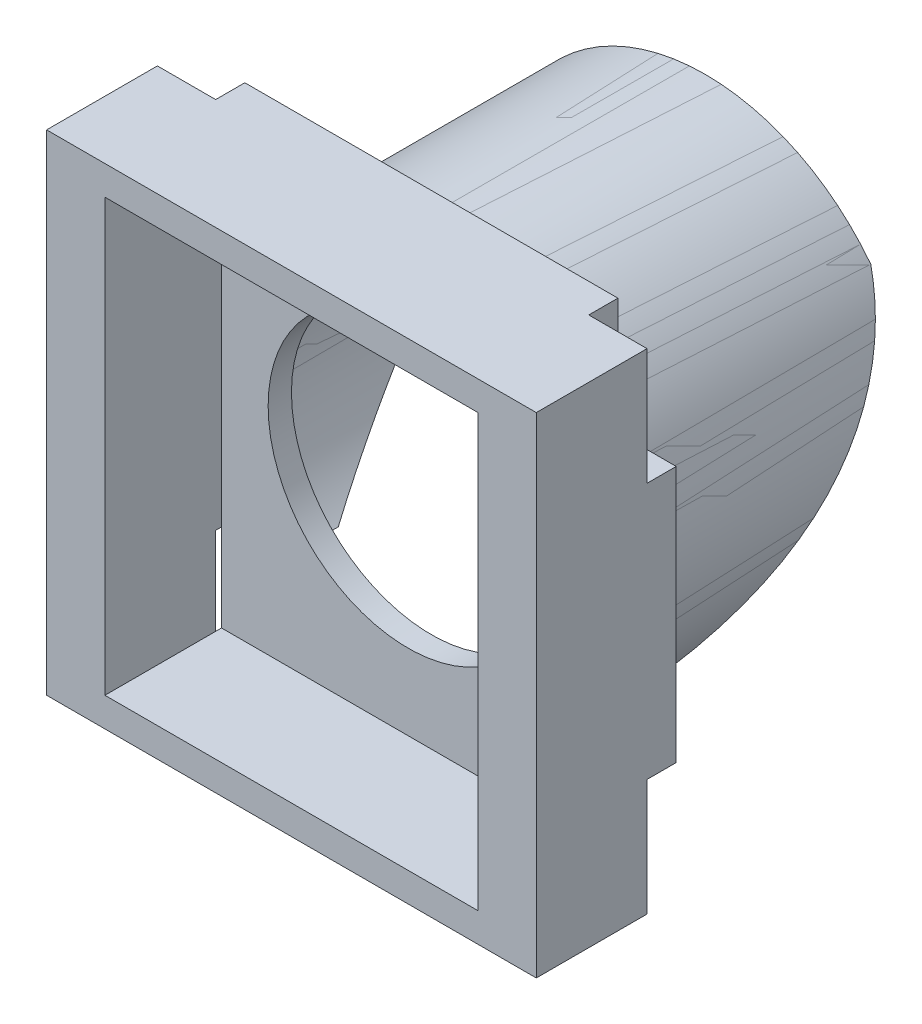
from build123d import *

# Parameters (mm, degrees)
SKETCH2_W           = 350
SKETCH2_H           = 1050
SKETCH2_R           = 100
BOSS_EXTRUDE2_DEPTH = 100
SCALE1_SCALE        = 0.24
SKETCH6_W           = 84
SKETCH6_H           = 168
CUT_EXTRUDE3_DEPTH  = 80
SKETCH11_W          = 64
SKETCH11_H          = 74
CUT_EXTRUDE8_DEPTH  = 20
SKETCH12_W          = 10
SKETCH12_H          = 5
BOSS_EXTRUDE6_DEPTH = 20
SKETCH13_W          = 10
SKETCH13_H          = 5
BOSS_EXTRUDE7_DEPTH = 20
SKETCH14_W          = 10
SKETCH14_H          = 5
CUT_EXTRUDE9_DEPTH  = 40
SKETCH15_W          = 10
SKETCH15_H          = 5
CUT_EXTRUDE10_DEPTH = 40
SKETCH16_W          = 10
SKETCH16_H          = 20
CUT_EXTRUDE11_DEPTH = 5
SKETCH17_W          = 10
SKETCH17_H          = 20
CUT_EXTRUDE12_DEPTH = 5
BOSS_EXTRUDE9_DEPTH = 47
SWEEP3_START        = -9
SWEEP3_DEPTH        = 47
CUT_EXTRUDE13_DEPTH = 82


# Read off the part's stored shape, not the designer's step: Sweep3
with BuildPart() as part:
    # Sketch2 → Boss-Extrude2 (new body)
    with BuildSketch(Plane.XY):
        with Locations((13.505164405, -303.545290931)):
            Rectangle(SKETCH2_W, SKETCH2_H)
        with Locations((13.505164405, 46.454709069)):
            Circle(SKETCH2_R, mode=Mode.SUBTRACT)
        with Locations((13.505164405, -303.545290931)):
            Circle(SKETCH2_R, mode=Mode.SUBTRACT)
        with Locations((13.505164405, -653.545290931)):
            Circle(SKETCH2_R, mode=Mode.SUBTRACT)
    extrude(amount=BOSS_EXTRUDE2_DEPTH)


with BuildPart() as part_1:
    # Scale1: scaled about (13.505164405, -303.545290931, 50)
    add(part.part.scale(SCALE1_SCALE).moved(Location((10.263924948, -230.694421108, 38))))

    # Sketch6 → Cut-Extrude3 (cut)
    with BuildSketch(Plane.XY.offset(62)):
        with Locations((13.505164405, -261.545290931)):
            Rectangle(SKETCH6_W, SKETCH6_H)
    extrude(amount=-CUT_EXTRUDE3_DEPTH, mode=Mode.SUBTRACT)

    # Sketch11 → Cut-Extrude8 (cut)
    with BuildSketch(Plane.XY.offset(62)):
        with Locations((13.505164405, -387.545290931)):
            Rectangle(SKETCH11_W, SKETCH11_H)
    extrude(amount=-CUT_EXTRUDE8_DEPTH, mode=Mode.SUBTRACT)

    # Sketch12 → Boss-Extrude6 (add)
    with BuildSketch(Plane(origin=(0, -429.545290931, 0), x_dir=(-1, 0, 0), z_dir=(0, -1, 0))):
        with Locations((23.494835595, -40.5)):
            Rectangle(SKETCH12_W, SKETCH12_H)
    extrude(amount=BOSS_EXTRUDE6_DEPTH)

    # Sketch13 → Boss-Extrude7 (add)
    with BuildSketch(Plane(origin=(0, -429.545290931, 0), x_dir=(-1, 0, 0), z_dir=(0, -1, 0))):
        with Locations((-50.505164405, -40.5)):
            Rectangle(SKETCH13_W, SKETCH13_H)
    extrude(amount=BOSS_EXTRUDE7_DEPTH)

    # Sketch14 → Cut-Extrude9 (cut)
    with BuildSketch(Plane.XZ.offset(449.545290931)):
        with Locations((-23.494835595, 40.5)):
            Rectangle(SKETCH14_W, SKETCH14_H)
    extrude(amount=-CUT_EXTRUDE9_DEPTH, mode=Mode.SUBTRACT)

    # Sketch15 → Cut-Extrude10 (cut)
    with BuildSketch(Plane(origin=(0, -449.545290931, 0), x_dir=(-1, 0, 0), z_dir=(0, -1, 0))):
        with Locations((-50.505164405, -40.5)):
            Rectangle(SKETCH15_W, SKETCH15_H)
    extrude(amount=-CUT_EXTRUDE10_DEPTH, mode=Mode.SUBTRACT)

    # Sketch16 → Cut-Extrude11 (cut)
    with BuildSketch(Plane(origin=(0, 0, 38), x_dir=(-1, 0, 0), z_dir=(0, 0, -1))):
        with Locations((23.494835595, -355.545290931)):
            Rectangle(SKETCH16_W, SKETCH16_H)
    extrude(amount=-CUT_EXTRUDE11_DEPTH, mode=Mode.SUBTRACT)

    # Sketch17 → Cut-Extrude12 (cut)
    with BuildSketch(Plane(origin=(0, 0, 38), x_dir=(-1, 0, 0), z_dir=(0, 0, -1))):
        with Locations((-50.505164405, -355.545290931)):
            Rectangle(SKETCH17_W, SKETCH17_H)
    extrude(amount=-CUT_EXTRUDE12_DEPTH, mode=Mode.SUBTRACT)

    # Sketch18 → Boss-Extrude9 (add)
    with BuildSketch(Plane(origin=(0, 0, 38), x_dir=(-1, 0, 0), z_dir=(0, 0, -1))):
        with BuildLine():
            Line((-35.671185106, -409.711311632), (-38.7770157, -412.817142227))
            ThreePointArc((-38.7770157, -412.817142227), (-13.505164405, -351.805496082), (11.766686891, -412.817142227))
            Line((11.766686891, -412.817142227), (8.660856297, -409.711311632))
            ThreePointArc((8.660856297, -409.711311632), (-13.505164405, -356.197803831), (-35.671185106, -409.711311632))
        make_face()
    extrude(amount=BOSS_EXTRUDE9_DEPTH)


with BuildPart() as body_2:
    # Sweep3 outline → Sweep3 (new body)
    with BuildSketch(Plane.XY.offset(SWEEP3_START)):
        with BuildLine():
            Line((35.671185106, -409.711311632), (38.7770157, -412.817142227))
            ThreePointArc((38.7770157, -412.817142227), (13.505164405, -351.805496082), (-11.766686891, -412.817142227))
            Line((-11.766686891, -412.817142227), (-8.660856297, -409.711311632))
            ThreePointArc((-8.660856297, -409.711311632), (13.505164404, -356.197803831), (35.671185106, -409.711311632))
        make_face()
    extrude(amount=SWEEP3_DEPTH)


with BuildPart() as cut_extrude13_tool:
    # Sketch27 → Cut-Extrude13 (new body)
    with BuildSketch(Plane.ZY.offset(28.494835595)):
        with BuildLine():
            Line((38, -412.817142227), (-9, -412.817142227))
            Line((-9, -412.817142227), (-9, -365.817142227))
            add(Edge.make_bspline(
                [(-9, -365.817142227), (5.370162337, -397.723377267), (38, -412.817142227)],
                knots=[0, 0, 0, 1, 1, 1], degree=2))
        make_face()
    extrude(amount=-CUT_EXTRUDE13_DEPTH)


with BuildPart() as part_2:
    add(part_1.part)

    # Cut-Extrude13: cut by cut_extrude13_tool
    add(cut_extrude13_tool.part, mode=Mode.SUBTRACT)


with BuildPart() as body_2_1:
    add(body_2.part)

    # Cut-Extrude13: cut by cut_extrude13_tool
    add(cut_extrude13_tool.part, mode=Mode.SUBTRACT)


solid = Compound([part_2.part, body_2_1.part])
